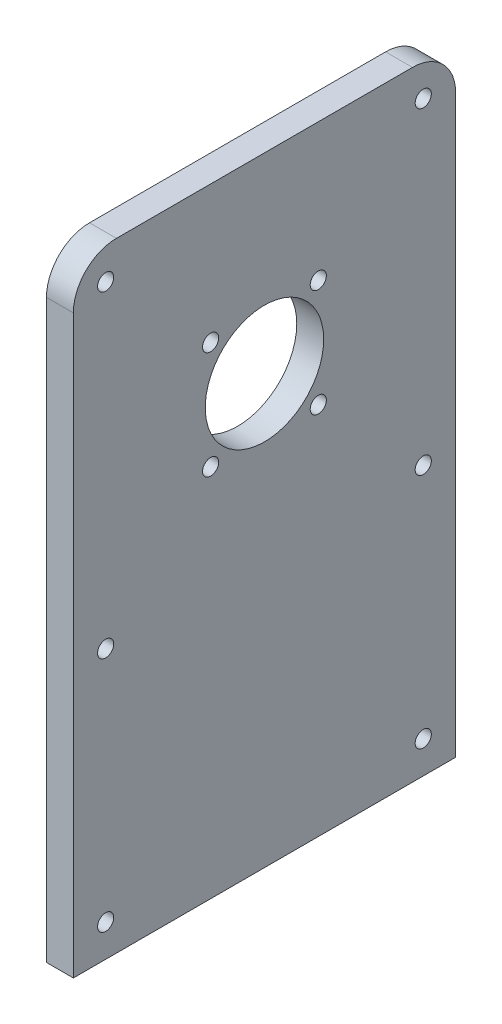
from build123d import *

# Parameters (mm, degrees)
SKETCH1_W           = 71
SKETCH1_H           = 115
SKETCH1_R           = 1.5
SKETCH1_R_2         = 11
BOSS_EXTRUDE1_DEPTH = 5
FILLET1_R           = 8


with BuildPart() as part:
    # Sketch1 → Boss-Extrude1 (new body)
    with BuildSketch(Plane(origin=(0, 0, 0), x_dir=(0, 0, -1), z_dir=(1, 0, 0))):
        with Locations((35.5, 57.5)):
            Rectangle(SKETCH1_W, SKETCH1_H)
        with Locations((6, 109)):
            Circle(SKETCH1_R, mode=Mode.SUBTRACT)
        with Locations((65, 109)):
            Circle(SKETCH1_R, mode=Mode.SUBTRACT)
        with Locations((35.5, 79.5)):
            Circle(SKETCH1_R_2, mode=Mode.SUBTRACT)
        with Locations((25.5, 89.5)):
            Circle(SKETCH1_R, mode=Mode.SUBTRACT)
        with Locations((45.5, 89.5)):
            Circle(SKETCH1_R, mode=Mode.SUBTRACT)
        with Locations((45.5, 69.5)):
            Circle(SKETCH1_R, mode=Mode.SUBTRACT)
        with Locations((25.5, 69.5)):
            Circle(SKETCH1_R, mode=Mode.SUBTRACT)
        with Locations((6, 50)):
            Circle(SKETCH1_R, mode=Mode.SUBTRACT)
        with Locations((65, 50)):
            Circle(SKETCH1_R, mode=Mode.SUBTRACT)
        with Locations((6, 6)):
            Circle(SKETCH1_R, mode=Mode.SUBTRACT)
        with Locations((65, 6)):
            Circle(SKETCH1_R, mode=Mode.SUBTRACT)
    extrude(amount=BOSS_EXTRUDE1_DEPTH)

    # Fillet1
    fillet1_edges = [part.edges().sort_by_distance(p)[0] for p in [
        (2.5, 115, -71),
        (2.5, 115, 0),
    ]]
    fillet(fillet1_edges, radius=FILLET1_R)


solid = part.part
